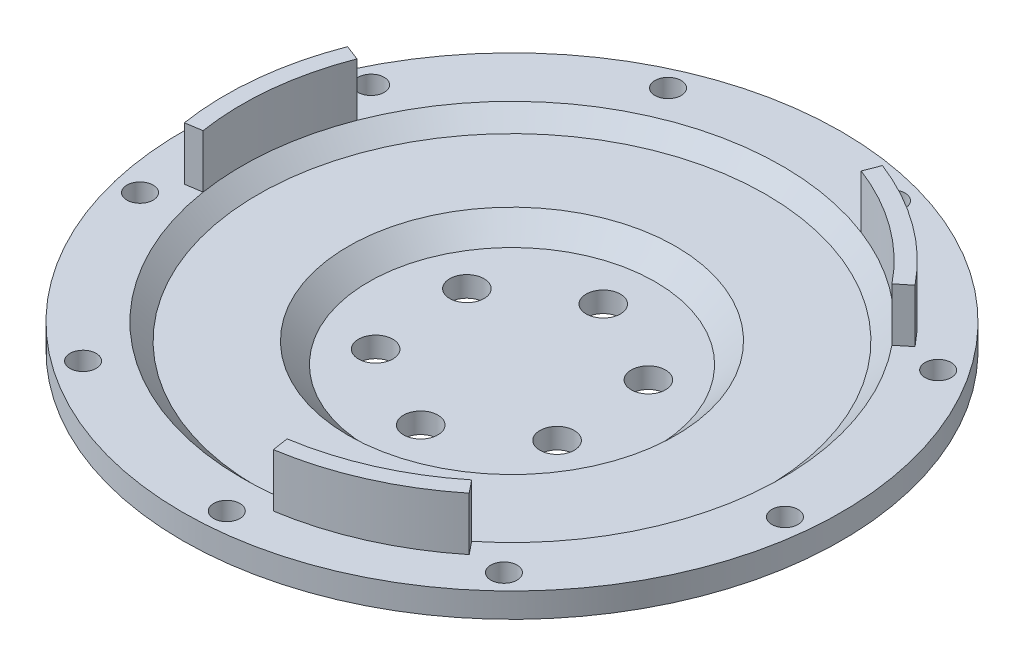
from build123d import *

# Parameters (mm, degrees)
EXTRUDE_START       = 2
SKETCH_3_R          = 40.25
SKETCH_3_R_2        = 1.6
SKETCH_3_R_3        = 17.5
EXTRUDE_1_DEPTH     = 3
SKETCH_3_4_R        = 17.5
SKETCH_3_4_R_2      = 2.1
EXTRUDE_3_DEPTH     = 2.5
CHAMFER_1_SIZE      = 3
CHAMFER_4_SIZE      = 2.5
SKETCH_4_R          = 40.25
SKETCH_4_R_2        = 33
SKETCH_4_R_3        = 1.6
EXTRUDE_4_DEPTH     = 2
CUT_EXTRUDE_START   = -13
SKETCH_4_4_R        = 40.25
SKETCH_4_4_R_2      = 33
SKETCH_4_4_R_3      = 1.6
CUT_EXTRUDE_4_DEPTH = 12
CHAMFER_5_SIZE      = 2
CHAMFER_8_SIZE      = 2
SKETCH_5_R          = 1.6
EXTRUDE_5_DEPTH     = 6.5


# Some blends are built 0.0001 mm under size
with BuildPart() as part:
    # 草图3 → 凸台-拉伸1 (new body)
    with BuildSketch(Plane(origin=(0, 0, 0), x_dir=(1, 0, 0), z_dir=(0, 1, 0)).offset(EXTRUDE_START)):
        with Locations(Location((-0.44726781, 0.687620087, 0), (0, 0, 270))):
            Circle(SKETCH_3_R)
        with Locations(Location((-15.663111428, 34.961926834, 0), (0, 0, 270))):
            Circle(SKETCH_3_R_2, mode=Mode.SUBTRACT)
        with Locations(Location((9.927819446, 36.723818061, 0), (0, 0, 270))):
            Circle(SKETCH_3_R_2, mode=Mode.SUBTRACT)
        with Locations(Location((30.664131688, 21.623971758, 0), (0, 0, 270))):
            Circle(SKETCH_3_R_2, mode=Mode.SUBTRACT)
        with Locations(Location((36.843074339, -3.272226173, 0), (0, 0, 270))):
            Circle(SKETCH_3_R_2, mode=Mode.SUBTRACT)
        with Locations(Location((25.573451463, -26.315568031, 0), (0, 0, 270))):
            Circle(SKETCH_3_R_2, mode=Mode.SUBTRACT)
        with Locations(Location((2.128444851, -36.723818061, 0), (0, 0, 270))):
            Circle(SKETCH_3_R_2, mode=Mode.SUBTRACT)
        with Locations(Location((-22.521766341, -29.6268404, 0), (0, 0, 270))):
            Circle(SKETCH_3_R_2, mode=Mode.SUBTRACT)
        with Locations(Location((-36.843074339, -8.34538977, 0), (0, 0, 270))):
            Circle(SKETCH_3_R_2, mode=Mode.SUBTRACT)
        with Locations(Location((-34.134379969, 17.162706563, 0), (0, 0, 270))):
            Circle(SKETCH_3_R_2, mode=Mode.SUBTRACT)
        with Locations(Location((-0.44726781, 0.687620087, 0), (0, 0, 270))):
            Circle(SKETCH_3_R_3, mode=Mode.SUBTRACT)
    extrude(amount=EXTRUDE_1_DEPTH)

    # 草图3<4> → 凸台-拉伸3 (add)
    with BuildSketch(Plane(origin=(0, 0, 0), x_dir=(1, 0, 0), z_dir=(0, 1, 0))):
        with Locations(Location((-0.44726781, 0.687620087, 0), (0, 0, 270))):
            Circle(SKETCH_3_4_R)
        with Locations(Location((-1.271495861, 12.659280294, 0), (0, 0, 270))):
            Circle(SKETCH_3_4_R_2, mode=Mode.SUBTRACT)
        with Locations(Location((9.508380029, 7.387252622, 0), (0, 0, 270))):
            Circle(SKETCH_3_4_R_2, mode=Mode.SUBTRACT)
        with Locations(Location((10.332608081, -4.584407586, 0), (0, 0, 270))):
            Circle(SKETCH_3_4_R_2, mode=Mode.SUBTRACT)
        with Locations(Location((0.376960242, -11.28404012, 0), (0, 0, 270))):
            Circle(SKETCH_3_4_R_2, mode=Mode.SUBTRACT)
        with Locations(Location((-10.402915649, -6.012012448, 0), (0, 0, 270))):
            Circle(SKETCH_3_4_R_2, mode=Mode.SUBTRACT)
        with Locations(Location((-11.227143701, 5.959647759, 0), (0, 0, 270))):
            Circle(SKETCH_3_4_R_2, mode=Mode.SUBTRACT)
    extrude(amount=EXTRUDE_3_DEPTH)

    # 倒角1
    # the kernel refuses this chamfer: 3 mm, written as the material it adds along each edge
    with BuildSketch(Plane(origin=(-0.44726781, 2, -0.687620087), x_dir=(0, 0, 1), z_dir=(-1, 0, 0))) as chamfer_1_piece_1_section:
        Polygon((17.5 + CHAMFER_1_SIZE, 0), (17.5, -CHAMFER_1_SIZE), (17.5, 0), align=None)
    chamfer_1_piece_1 = revolve(axis=Axis((-0.44726781, 2, -0.687620087), (0, 1, 0)), mode=Mode.PRIVATE)
    chamfer_1_piece_1 = split(chamfer_1_piece_1, bisect_by=Plane(origin=(-0.44726781, 0, -20.17366548), z_dir=(0, 1, 0)), keep=Keep.TOP, mode=Mode.PRIVATE)
    add(chamfer_1_piece_1)

    # 倒角4
    chamfer_4_edges = [part.edges().sort_by_distance(p)[0] for p in [
        (-0.44726781, 5, -18.187620087),
    ]]
    chamfer(chamfer_4_edges, length=CHAMFER_4_SIZE - 0.0001)  # a hair under: the kernel refuses the full size

    # 草图4 → 凸台-拉伸4 (add)
    with BuildSketch(Plane(origin=(0, 5, 0), x_dir=(1, 0, 0), z_dir=(0, 1, 0))):
        with Locations(Location((-0.44726781, 0.687620087, 0), (0, 0, 270))):
            Circle(SKETCH_4_R)
        with Locations(Location((-0.44726781, 0.687620087, 0), (0, 0, 270))):
            Circle(SKETCH_4_R_2, mode=Mode.SUBTRACT)
        with Locations(Location((-36.843074339, -8.34538977, 0), (0, 0, 270))):
            Circle(SKETCH_4_R_3, mode=Mode.SUBTRACT)
        with Locations(Location((-22.521766341, -29.6268404, 0), (0, 0, 270))):
            Circle(SKETCH_4_R_3, mode=Mode.SUBTRACT)
        with Locations(Location((2.128444851, -36.723818061, 0), (0, 0, 270))):
            Circle(SKETCH_4_R_3, mode=Mode.SUBTRACT)
        with Locations(Location((25.573451463, -26.315568031, 0), (0, 0, 270))):
            Circle(SKETCH_4_R_3, mode=Mode.SUBTRACT)
        with Locations(Location((36.843074339, -3.272226173, 0), (0, 0, 270))):
            Circle(SKETCH_4_R_3, mode=Mode.SUBTRACT)
        with Locations(Location((30.664131688, 21.623971758, 0), (0, 0, 270))):
            Circle(SKETCH_4_R_3, mode=Mode.SUBTRACT)
        with Locations(Location((9.927819446, 36.723818061, 0), (0, 0, 270))):
            Circle(SKETCH_4_R_3, mode=Mode.SUBTRACT)
        with Locations(Location((-15.663111428, 34.961926834, 0), (0, 0, 270))):
            Circle(SKETCH_4_R_3, mode=Mode.SUBTRACT)
        with Locations(Location((-34.134379969, 17.162706563, 0), (0, 0, 270))):
            Circle(SKETCH_4_R_3, mode=Mode.SUBTRACT)
    extrude(amount=EXTRUDE_4_DEPTH)

    # 草图4<4> → 切除-拉伸4 (cut)
    with BuildSketch(Plane(origin=(0, 5, 0), x_dir=(1, 0, 0), z_dir=(0, 1, 0)).offset(CUT_EXTRUDE_START)):
        with Locations(Location((-0.44726781, 0.687620087, 0), (0, 0, 270))):
            Circle(SKETCH_4_4_R)
        with Locations(Location((-0.44726781, 0.687620087, 0), (0, 0, 270))):
            Circle(SKETCH_4_4_R_2, mode=Mode.SUBTRACT)
        with Locations(Location((-36.843074339, -8.34538977, 0), (0, 0, 270))):
            Circle(SKETCH_4_4_R_3, mode=Mode.SUBTRACT)
        with Locations(Location((-22.521766341, -29.6268404, 0), (0, 0, 270))):
            Circle(SKETCH_4_4_R_3, mode=Mode.SUBTRACT)
        with Locations(Location((2.128444851, -36.723818061, 0), (0, 0, 270))):
            Circle(SKETCH_4_4_R_3, mode=Mode.SUBTRACT)
        with Locations(Location((25.573451463, -26.315568031, 0), (0, 0, 270))):
            Circle(SKETCH_4_4_R_3, mode=Mode.SUBTRACT)
        with Locations(Location((36.843074339, -3.272226173, 0), (0, 0, 270))):
            Circle(SKETCH_4_4_R_3, mode=Mode.SUBTRACT)
        with Locations(Location((30.664131688, 21.623971758, 0), (0, 0, 270))):
            Circle(SKETCH_4_4_R_3, mode=Mode.SUBTRACT)
        with Locations(Location((9.927819446, 36.723818061, 0), (0, 0, 270))):
            Circle(SKETCH_4_4_R_3, mode=Mode.SUBTRACT)
        with Locations(Location((-15.663111428, 34.961926834, 0), (0, 0, 270))):
            Circle(SKETCH_4_4_R_3, mode=Mode.SUBTRACT)
        with Locations(Location((-34.134379969, 17.162706563, 0), (0, 0, 270))):
            Circle(SKETCH_4_4_R_3, mode=Mode.SUBTRACT)
    extrude(amount=CUT_EXTRUDE_4_DEPTH, mode=Mode.SUBTRACT)

    # 倒角5
    chamfer_5_edges = [part.edges().sort_by_distance(p)[0] for p in [
        (-0.44726781, 5, -33.687620087),
    ]]
    chamfer(chamfer_5_edges, length=CHAMFER_5_SIZE - 0.0001)  # a hair under: the kernel refuses the full size

    # 倒角8
    chamfer_8_edges = [part.edges().sort_by_distance(p)[0] for p in [
        (-0.44726781, 2, -33.687620087),
    ]]
    chamfer(chamfer_8_edges, length=CHAMFER_8_SIZE - 0.0001)  # a hair under: the kernel refuses the full size

    # 草图5 → 凸台-拉伸5 (add)
    with BuildSketch(Plane(origin=(0, 7, 0), x_dir=(1, 0, 0), z_dir=(0, 1, 0))):
        with Locations(Location((9.927819446, 36.723818061, 0), (0, 0, 270))):
            Circle(SKETCH_5_R)
        with BuildLine():
            Line((21.54973721, -26.536115332), (20.292765494, -24.980473308))
            ThreePointArc((20.292765494, -24.980473308), (12.942674574, -29.47376985), (4.680081209, -31.911617512))
            Line((4.680081209, -31.911617512), (4.990829634, -33.887328882))
            ThreePointArc((4.990829634, -33.887328882), (13.754186234, -31.301732877), (21.54973721, -26.536115332))
        make_face()
        with BuildLine():
            Line((12.130676139, 33.34945295), (11.411936485, 31.483062501))
            ThreePointArc((11.411936485, 31.483062501), (18.978290897, 27.364345315), (25.220825585, 21.427653391))
            Line((25.220825585, 21.427653391), (26.776467609, 22.684625106))
            ThreePointArc((26.776467609, 22.684625106), (20.155597485, 28.981116541), (12.130676139, 33.34945295))
        make_face()
        with BuildLine():
            Line((-35.022216779, -4.750477357), (-33.046505409, -4.439728932))
            ThreePointArc((-33.046505409, -4.439728932), (-33.262768901, 4.172284796), (-31.242710224, 12.546824382))
            Line((-31.242710224, 12.546824382), (-33.109100673, 13.265564036))
            ThreePointArc((-33.109100673, 13.265564036), (-35.251587149, 4.383476596), (-35.022216779, -4.750477357))
        make_face()
    extrude(amount=EXTRUDE_5_DEPTH)


with BuildPart() as extrude_5_kept_piece:
    # of the separate pieces the step leaves, the one the design keeps (extrude_5_pieces_kept)
    add(part.part.solids().sort_by_distance((-0.44726781, 3.9999, 32.312379913))[0])


solid = extrude_5_kept_piece.part
